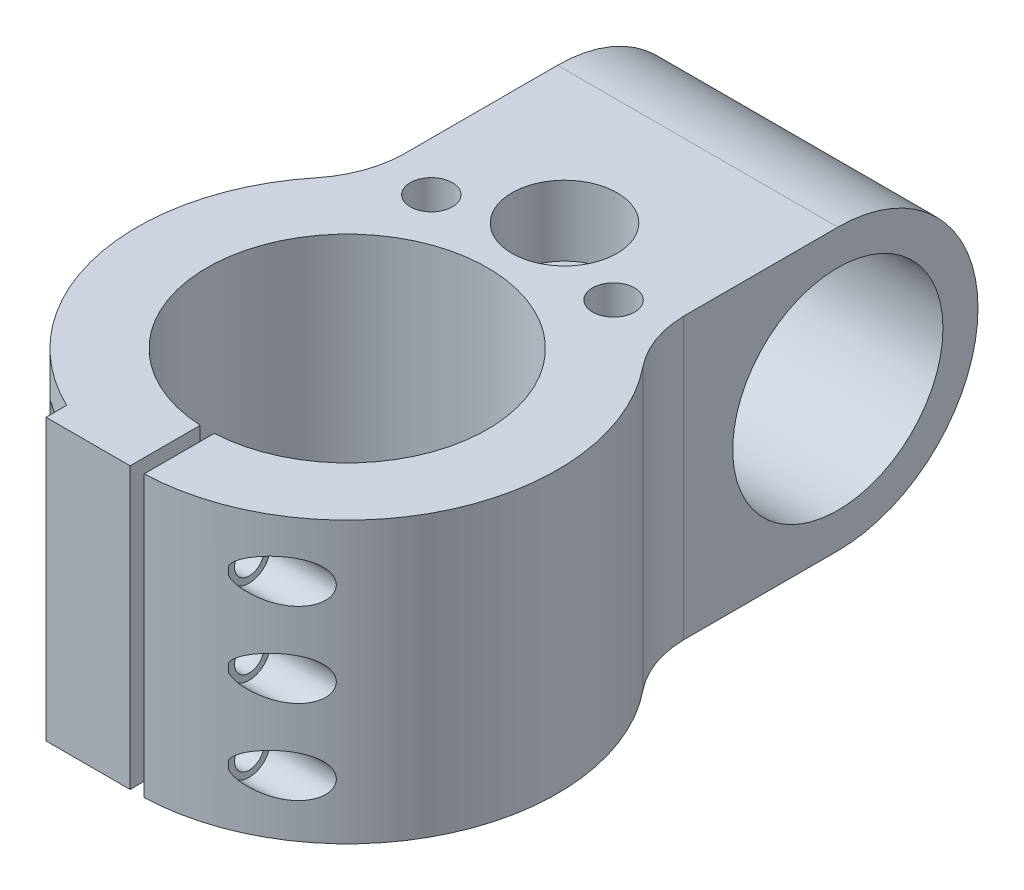
from build123d import *

# Parameters (mm, degrees)
SKETCH1_R                                    = 30
SKETCH1_R_2                                  = 20
BOSS_EXTRUDE1_DEPTH                          = 40
SKETCH2_W                                    = 2
SKETCH2_H                                    = 30
CUT_EXTRUDE1_DEPTH                           = 59.309518948
BOSS_EXTRUDE2_START                          = -40
BOSS_EXTRUDE2_DEPTH                          = 40
CBORE_FOR_M4_HEX_SOCKET_HEAD_CAP_SCR_2_COUNT = 2
CBORE_FOR_M4_HEX_SOCKET_HEAD_CAP_SCR_2_PITCH = 12
CBORE_FOR_M4_HEX_SOCKET_HEAD_CAP_SCR_3_COUNT = 2
CBORE_FOR_M4_HEX_SOCKET_HEAD_CAP_SCR_3_PITCH = 24
SKETCH6_R                                    = 3.75
CUT_EXTRUDE2_DEPTH                           = 66.946948375
F_5_4_5_4_DIAMETER_HOLE1_D                   = 4.2
SKETCH10_R                                   = 3
CUT_EXTRUDE3_DEPTH                           = 11
BOSS_EXTRUDE4_START                          = -20
BOSS_EXTRUDE4_OUTLINE_R                      = 15
BOSS_EXTRUDE4_DEPTH                          = 40
FILLET1_R                                    = 15
SKETCH22_R                                   = 3.25
CUT_EXTRUDE4_DEPTH                           = 87.023252752
SKETCH23_R                                   = 7.5
CUT_EXTRUDE5_DEPTH                           = 10
CHAMFER1_SIZE                                = 3
CUT_EXTRUDE6_START                           = -6
SKETCH24_R                                   = 7.5
CUT_EXTRUDE6_DEPTH                           = 6
CHAMFER2_SIZE                                = 3
F_6_0MM_DOWEL_HOLE1_D                        = 6


# Read off the part's stored shape, not the designer's step: Boss-Extrude4
with BuildPart() as part:
    # Sketch1 → Boss-Extrude1 (new body)
    with BuildSketch(Plane(origin=(0, 0, 0), x_dir=(1, 0, 0), z_dir=(0, 1, 0))):
        with Locations(Location((0, 0, 0), (0, 0, 270))):
            Circle(SKETCH1_R)
        with Locations(Location((0, 0, 0), (0, 0, 270))):
            Circle(SKETCH1_R_2, mode=Mode.SUBTRACT)
    extrude(amount=BOSS_EXTRUDE1_DEPTH)

    # Sketch2 → Cut-Extrude1 (cut, through all)
    with BuildSketch(Plane(origin=(0, 40, 0), x_dir=(1, 0, 0), z_dir=(0, 1, 0))):
        with Locations((0, -15)):
            Rectangle(SKETCH2_W, SKETCH2_H)
    extrude(amount=-CUT_EXTRUDE1_DEPTH, mode=Mode.SUBTRACT)

    # Sketch3 → Boss-Extrude2 (add)
    with BuildSketch(Plane(origin=(0, 40, 0), x_dir=(1, 0, 0), z_dir=(0, 1, 0)).offset(BOSS_EXTRUDE2_START)):
        with BuildLine():
            Line((-1, -29.983328701), (-13, -29.983328701))
            Line((-13, -29.983328701), (-13, -27.037011669))
            ThreePointArc((-13, -27.037011669), (-7.153334608, -29.134683866), (-1, -29.983328701))
        make_face()
    extrude(amount=BOSS_EXTRUDE2_DEPTH)

    # Sketch5 → CBORE for M4 Hex Socket Head Cap Screw1 (revolve, cut)
    with BuildSketch(Plane(origin=(-13, 32, 24.979156528), x_dir=(0, 0, 1), z_dir=(0, 1, 0))):
        Polygon((0, 0), (0, 13.351936393), (2.25, 12), (2.25, 4), (3.75, 4), (3.75, 0), align=None)
    cbore_for_m4_hex_socket_head_cap_screw1 = revolve(axis=Axis((-19.35, 32, 24.979156528), (1, 0, 0)), mode=Mode.SUBTRACT)

    # CBORE for M4 Hex Socket Head Cap Scr 2: CBORE for M4 Hex Socket Head Cap Screw1 ×2
    with Locations(*[(0, -i * CBORE_FOR_M4_HEX_SOCKET_HEAD_CAP_SCR_2_PITCH, 0) for i in range(1, CBORE_FOR_M4_HEX_SOCKET_HEAD_CAP_SCR_2_COUNT)]):
        add(cbore_for_m4_hex_socket_head_cap_screw1, mode=Mode.SUBTRACT)

    # CBORE for M4 Hex Socket Head Cap Scr 3: CBORE for M4 Hex Socket Head Cap Screw1 ×2
    with Locations(*[(0, -i * CBORE_FOR_M4_HEX_SOCKET_HEAD_CAP_SCR_3_PITCH, 0) for i in range(1, CBORE_FOR_M4_HEX_SOCKET_HEAD_CAP_SCR_3_COUNT)]):
        add(cbore_for_m4_hex_socket_head_cap_screw1, mode=Mode.SUBTRACT)

    # Sketch6 → Cut-Extrude2 (cut, through all)
    with BuildSketch(Plane.ZY.offset(13)):
        with Locations((24.979156528, 32)):
            Circle(SKETCH6_R)
        with Locations((24.979156528, 20)):
            Circle(SKETCH6_R)
        with Locations((24.979156528, 8)):
            Circle(SKETCH6_R)
    extrude(amount=CUT_EXTRUDE2_DEPTH, mode=Mode.SUBTRACT)

    # Ø5.4 (5.4) Diameter Hole1 (through all)
    with Locations(Plane.ZY.offset(-1)):
        with Locations((24.979156528, 8), (24.979156528, 20), (24.979156528, 32)):
            Hole(F_5_4_5_4_DIAMETER_HOLE1_D / 2)

    # Sketch10 → Cut-Extrude3 (cut)
    with BuildSketch(Plane.ZY.offset(-22)):
        with Locations((24.979156528, 8)):
            Circle(SKETCH10_R)
        with Locations((24.979156528, 32)):
            Circle(SKETCH10_R)
        with Locations((24.979156528, 20)):
            Circle(SKETCH10_R)
    extrude(amount=CUT_EXTRUDE3_DEPTH, mode=Mode.SUBTRACT)

    # Boss-Extrude4 outline → Boss-Extrude4 (add)
    with BuildSketch(Plane(origin=(0, 0, 0), x_dir=(0, 0, -1), z_dir=(1, 0, 0)).offset(BOSS_EXTRUDE4_START)):
        with BuildLine():
            ThreePointArc((50, 0), (70, 20), (50, 40))
            Line((50, 40), (28, 40))
            Line((28, 40), (28, 0))
            Line((28, 0), (50, 0))
        make_face()
        with Locations((50, 20)):
            Circle(BOSS_EXTRUDE4_OUTLINE_R, mode=Mode.SUBTRACT)
    extrude(amount=BOSS_EXTRUDE4_DEPTH)

    # Fillet1
    # the kernel refuses this fillet: 15 mm, written as the material it adds along each edge
    with BuildSketch(Plane(origin=(10.770329614, 40, -28), x_dir=(0.8085477056225361, 0, 0.5884306311983875), z_dir=(0, -1, 0))) as fillet1_piece_1:
        with BuildLine():
            CenterArc((19.419330938, -14.488463805), FILLET1_R, 105.006250165, 37.84908673)
            Line((7.462628814, -5.431020771), (0, 0))
            ThreePointArc((0, 0), (7.767732375, -1.023072389), (15.53546475, 0))
        make_face()
    extrude(amount=40)
    with BuildSketch(Plane(origin=(-10.770329614, 40, -28), x_dir=(-0.8085477056225359, 0, 0.5884306311983878), z_dir=(0, -1, 0))) as fillet1_piece_2:
        with BuildLine():
            CenterArc((19.419330938, 14.488463805), FILLET1_R, 217.144663105, 37.84908673)
            Line((7.462628814, 5.431020771), (0, 0))
            ThreePointArc((0, 0), (7.767732375, 1.023072389), (15.53546475, 0))
        make_face()
    extrude(amount=40)

    # Sketch22 → Cut-Extrude4 (cut, through all)
    with BuildSketch(Plane(origin=(0, 40, 0), x_dir=(1, 0, 0), z_dir=(0, 1, 0))):
        with Locations(Location((0, 31, 0), (0, 0, 270))):
            Circle(SKETCH22_R)
    extrude(amount=-CUT_EXTRUDE4_DEPTH, mode=Mode.SUBTRACT)

    # Sketch23 → Cut-Extrude5 (cut)
    with BuildSketch(Plane(origin=(0, 40, 0), x_dir=(1, 0, 0), z_dir=(0, 1, 0))):
        with Locations(Location((0, 31, 0), (0, 0, 270))):
            Circle(SKETCH23_R)
    extrude(amount=-CUT_EXTRUDE5_DEPTH, mode=Mode.SUBTRACT)

    # Chamfer1
    chamfer1_edges = [part.edges().sort_by_distance(p)[0] for p in [
        (0, 30, -34.25),
    ]]
    chamfer(chamfer1_edges, length=CHAMFER1_SIZE)

    # Sketch24 → Cut-Extrude6 (cut)
    with BuildSketch(Plane.XZ.offset(CUT_EXTRUDE6_START)):
        with Locations(Location((0, -31, 0), (0, 0, 90))):
            Circle(SKETCH24_R)
    extrude(amount=CUT_EXTRUDE6_DEPTH, mode=Mode.SUBTRACT)

    # Chamfer2
    chamfer2_edges = [part.edges().sort_by_distance(p)[0] for p in [
        (0, 6, -34.25),
    ]]
    chamfer(chamfer2_edges, length=CHAMFER2_SIZE)

    # Ø6.0mm Dowel Hole1 (through all)
    with Locations(Plane(origin=(0, 0, 0), x_dir=(-1, 0, 0), z_dir=(0, -1, 0))):
        with Locations((13, 25), (-13, 25)):
            Hole(F_6_0MM_DOWEL_HOLE1_D / 2)


solid = part.part
